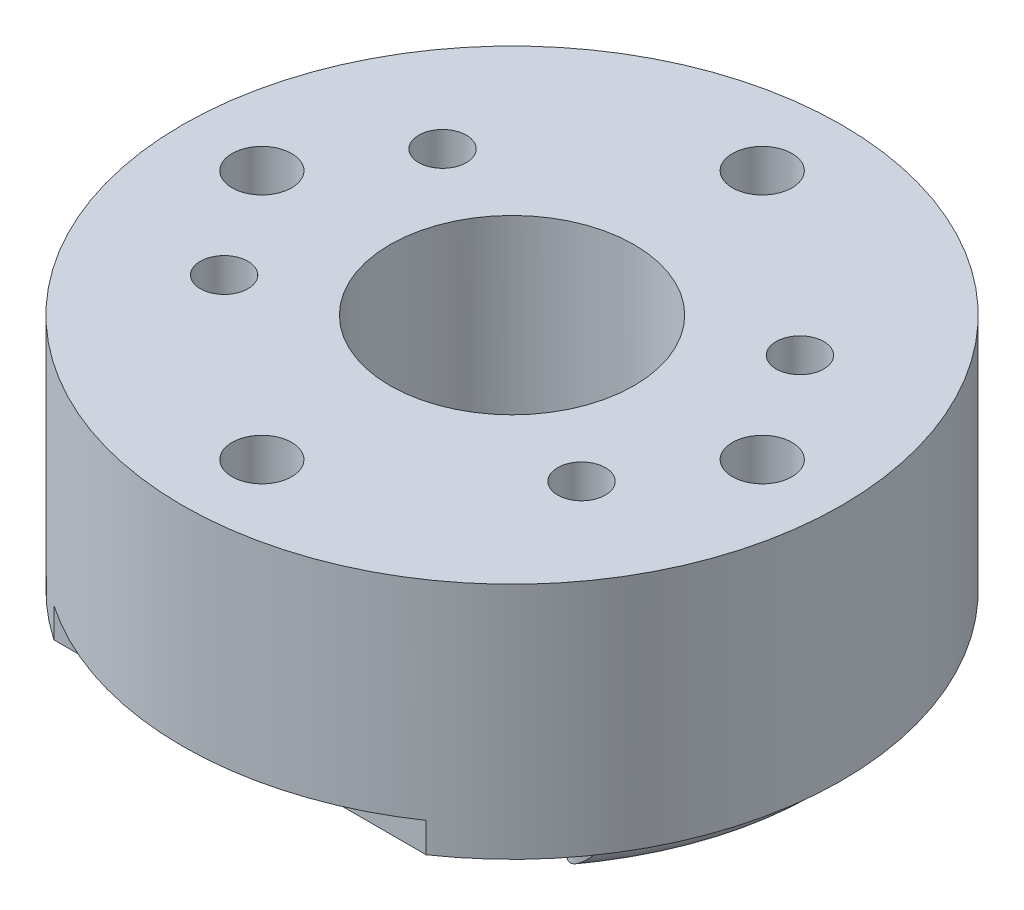
from build123d import *

# Parameters (mm, degrees)
SKETCH4_R           = 16.6
SKETCH4_R_2         = 6.15
BOSS_EXTRUDE1_DEPTH = 12
BOSS_EXTRUDE2_DEPTH = 1.5
SKETCH6_R           = 1.2
CUT_EXTRUDE1_DEPTH  = 27.365128484
SKETCH7_R           = 1.5
CUT_EXTRUDE2_DEPTH  = 28.08080501
FILLET1_R           = 1
FILLET2_R           = 1
SKETCH8_W           = 20
SKETCH8_H           = 5
CUT_EXTRUDE3_DEPTH  = 1.5


with BuildPart() as part:
    # Sketch4 → Boss-Extrude1 (new body)
    with BuildSketch(Plane(origin=(0, 0, 0), x_dir=(1, 0, 0), z_dir=(0, 1, 0))):
        with Locations(Location((0, 0, 0), (0, 0, 270))):
            Circle(SKETCH4_R)
        with Locations(Location((0, 0, 0), (0, 0, 270))):
            Circle(SKETCH4_R_2, mode=Mode.SUBTRACT)
    extrude(amount=-BOSS_EXTRUDE1_DEPTH)

    # Sketch5 → Boss-Extrude2 (add)
    with BuildSketch(Plane.XZ.offset(12)):
        with BuildLine():
            Line((11.2, 10.859097568), (11.2, -7.7))
            Line((11.2, -7.7), (-11.2, -7.7))
            Line((-11.2, -7.7), (-11.2, 10.859097568))
            ThreePointArc((-11.2, 10.859097568), (0, -15.6), (11.2, 10.859097568))
        make_face()
    extrude(amount=BOSS_EXTRUDE2_DEPTH)

    # Sketch6 → Cut-Extrude1 (cut, through all)
    with BuildSketch(Plane.XZ.offset(12)):
        with Locations((9, -5.5)):
            Circle(SKETCH6_R)
        with Locations((9, 5.5)):
            Circle(SKETCH6_R)
        with Locations((-9, 5.5)):
            Circle(SKETCH6_R)
        with Locations((-9, -5.5)):
            Circle(SKETCH6_R)
    extrude(amount=-CUT_EXTRUDE1_DEPTH, mode=Mode.SUBTRACT)

    # Sketch7 → Cut-Extrude2 (cut, through all)
    with BuildSketch(Plane(origin=(0, 0, 0), x_dir=(1, 0, 0), z_dir=(0, 1, 0))):
        with Locations(Location((0, 12.6, 0), (0, 0, 270))):
            Circle(SKETCH7_R)
        with Locations(Location((12.6, 0, 0), (0, 0, 270))):
            Circle(SKETCH7_R)
        with Locations(Location((-12.6, 0, 0), (0, 0, 270))):
            Circle(SKETCH7_R)
        with Locations(Location((0, -12.6, 0), (0, 0, 270))):
            Circle(SKETCH7_R)
    extrude(amount=-CUT_EXTRUDE2_DEPTH, mode=Mode.SUBTRACT)

    # Fillet1
    fillet1_edges = [part.edges().sort_by_distance(p)[0] for p in [
        (-11.2, -12.75, 10.859097568),
        (11.2, -12.75, 10.859097568),
    ]]
    fillet(fillet1_edges, radius=FILLET1_R)

    # Fillet2
    # the kernel refuses this fillet: 1 mm, written as the material it takes off along each edge
    with BuildSketch(Plane(origin=(0, -13.5, 0), x_dir=(-0.7369271930502395, 0, 0.675972123791429), z_dir=(0.675972123791429, 0, 0.7369271930502395))) as fillet2_piece_1:
        with BuildLine():
            CenterArc((15.6 - FILLET2_R, -FILLET2_R), FILLET2_R, 0, 90)
            Line((15.6 - FILLET2_R, 0), (15.6, 0))
            Line((15.6, 0), (15.6, -FILLET2_R))
        make_face()
    revolve(axis=Axis((0, -13.5, 0), (0, -1, 0)), revolution_arc=265.059373538, mode=Mode.SUBTRACT)

    # Sketch8 → Cut-Extrude3 (cut)
    with BuildSketch(Plane.XZ.offset(12)):
        with Locations((0, 16.2)):
            Rectangle(SKETCH8_W, SKETCH8_H)
        Polygon((3.35, 11.5), (-5.2, 11.5), (-5.2, 9), (-3.65, 9), (-3.65, 4.5), (3.35, 4.5), align=None)
    extrude(amount=-CUT_EXTRUDE3_DEPTH, mode=Mode.SUBTRACT)


solid = part.part
